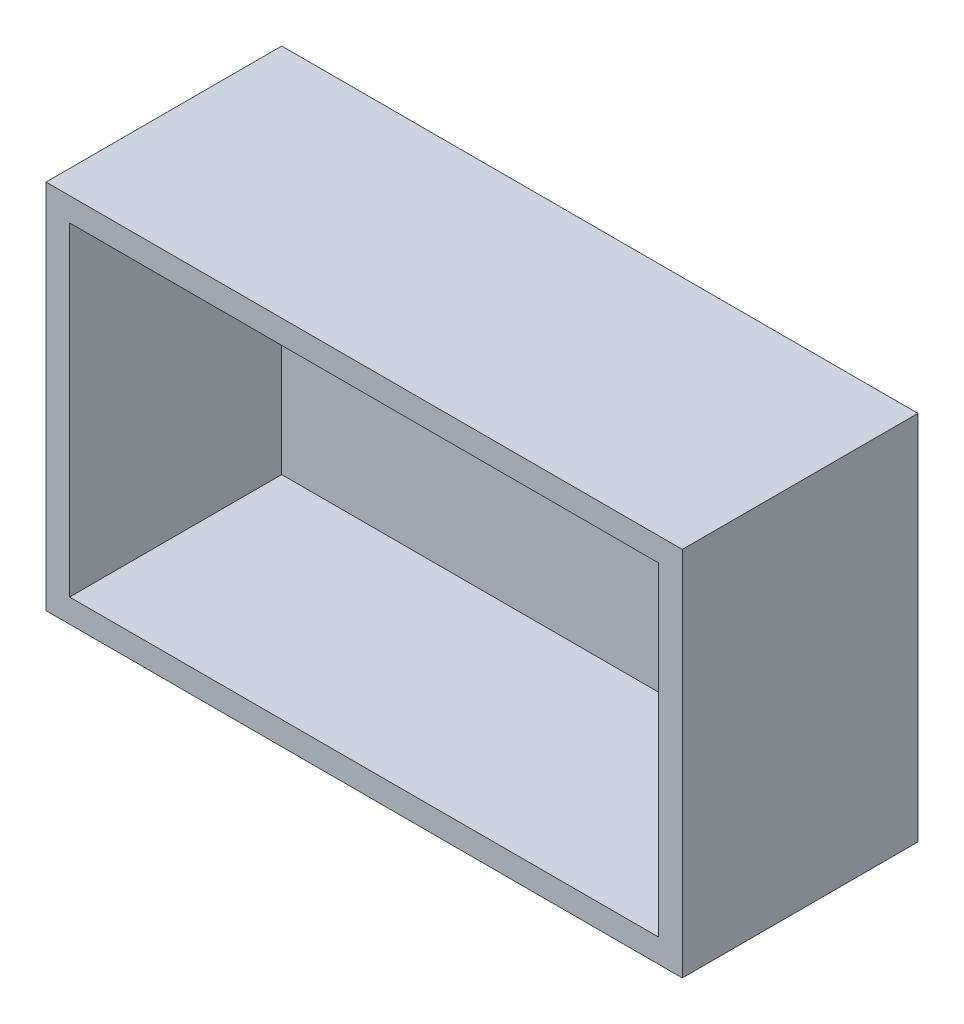
from build123d import *

# Parameters (mm, degrees)
SKETCH3_W           = 54
SKETCH3_H           = 31.5
BOSS_EXTRUDE1_DEPTH = 20
SHELL7_T            = -2


with BuildPart() as part:
    # Sketch3 → Boss-Extrude1 (new body)
    with BuildSketch(Plane.XY):
        with Locations((27, 15.75)):
            Rectangle(SKETCH3_W, SKETCH3_H)
    extrude(amount=BOSS_EXTRUDE1_DEPTH)

    # Shell7
    shell7_openings = [part.faces().sort_by_distance(p)[0] for p in [
        (27, 15.75, 20),
    ]]
    offset(amount=SHELL7_T, openings=shell7_openings, kind=Kind.INTERSECTION)


solid = part.part
